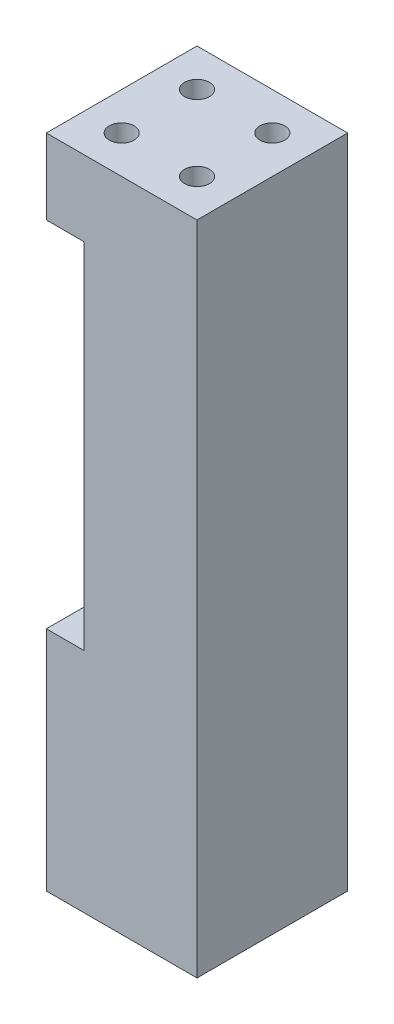
from build123d import *

# Parameters (mm, degrees)
EXTRUDE_1_DEPTH             = 20
HOLE_WIZARD_M4_1_AT_2_COUNT = 2
HOLE_WIZARD_M4_1_AT_2_PITCH = 10
HOLE_WIZARD_M4_1_AT_3_COUNT = 2
HOLE_WIZARD_M4_1_AT_3_PITCH = 10
HOLE_WIZARD_M4_1_AT_4_COUNT = 2
HOLE_WIZARD_M4_1_AT_4_PITCH = 14.142135624


with BuildPart() as part:
    # 草图1 → 凸台-拉伸1 (new body)
    with BuildSketch(Plane.XY):
        Polygon((-20, 30.15), (-15, 30.15), (-15, 77.15), (-20, 77.15), (-20, 87.15), (0, 87.15), (0, 0), (-20, 0), align=None)
    extrude(amount=EXTRUDE_1_DEPTH)

    # 草图3 → M4 螺纹孔1 (revolve, cut)
    with BuildSketch(Plane(origin=(-15, 87.15, 5), x_dir=(0, 0, 1), z_dir=(1, 0, 0))):
        Polygon((0, 0), (0, 11.091420021), (1.65, 10.1), (1.65, 0), align=None)
    hole_wizard_m4_1 = revolve(axis=Axis((-15, 93.5, 5), (0, -1, 0)), mode=Mode.SUBTRACT)

    # M4 螺纹孔1 at 2: M4 螺纹孔1 ×2
    with Locations(*[(i * HOLE_WIZARD_M4_1_AT_2_PITCH, 0, 0) for i in range(1, HOLE_WIZARD_M4_1_AT_2_COUNT)]):
        add(hole_wizard_m4_1, mode=Mode.SUBTRACT)

    # M4 螺纹孔1 at 3: M4 螺纹孔1 ×2
    with Locations(*[(0, 0, i * HOLE_WIZARD_M4_1_AT_3_PITCH) for i in range(1, HOLE_WIZARD_M4_1_AT_3_COUNT)]):
        add(hole_wizard_m4_1, mode=Mode.SUBTRACT)

    # M4 螺纹孔1 at 4: M4 螺纹孔1 ×2
    with Locations(*[Vector(0.7071067811865476, 0, 0.7071067811865476) * (i * HOLE_WIZARD_M4_1_AT_4_PITCH) for i in range(1, HOLE_WIZARD_M4_1_AT_4_COUNT)]):
        add(hole_wizard_m4_1, mode=Mode.SUBTRACT)

    # 镜向1: M4 螺纹孔1 across plane
    add(hole_wizard_m4_1.mirror(Plane.ZX.offset(43.575)), mode=Mode.SUBTRACT)

    # 镜向1 copy 1 sketch → 镜向1 copy 1 (revolve, cut)
    with BuildSketch(Plane(origin=(-5, 0, 5), x_dir=(0, 0, 1), z_dir=(1, 0, 0))):
        Polygon((0, 0), (0, -11.091420021), (1.65, -10.1), (1.65, 0), align=None)
    revolve(axis=Axis((-5, -6.35, 5), (0, -1, 0)), mode=Mode.SUBTRACT)

    # 镜向1 copy 2 sketch → 镜向1 copy 2 (revolve, cut)
    with BuildSketch(Plane(origin=(-15, 0, 15), x_dir=(0, 0, 1), z_dir=(1, 0, 0))):
        Polygon((0, 0), (0, -11.091420021), (1.65, -10.1), (1.65, 0), align=None)
    revolve(axis=Axis((-15, -6.35, 15), (0, -1, 0)), mode=Mode.SUBTRACT)

    # 镜向1 copy 3 sketch → 镜向1 copy 3 (revolve, cut)
    with BuildSketch(Plane(origin=(-5, 0, 15), x_dir=(0, 0, 1), z_dir=(1, 0, 0))):
        Polygon((0, 0), (0, -11.091420021), (1.65, -10.1), (1.65, 0), align=None)
    revolve(axis=Axis((-5, -6.35, 15), (0, -1, 0)), mode=Mode.SUBTRACT)


solid = part.part
